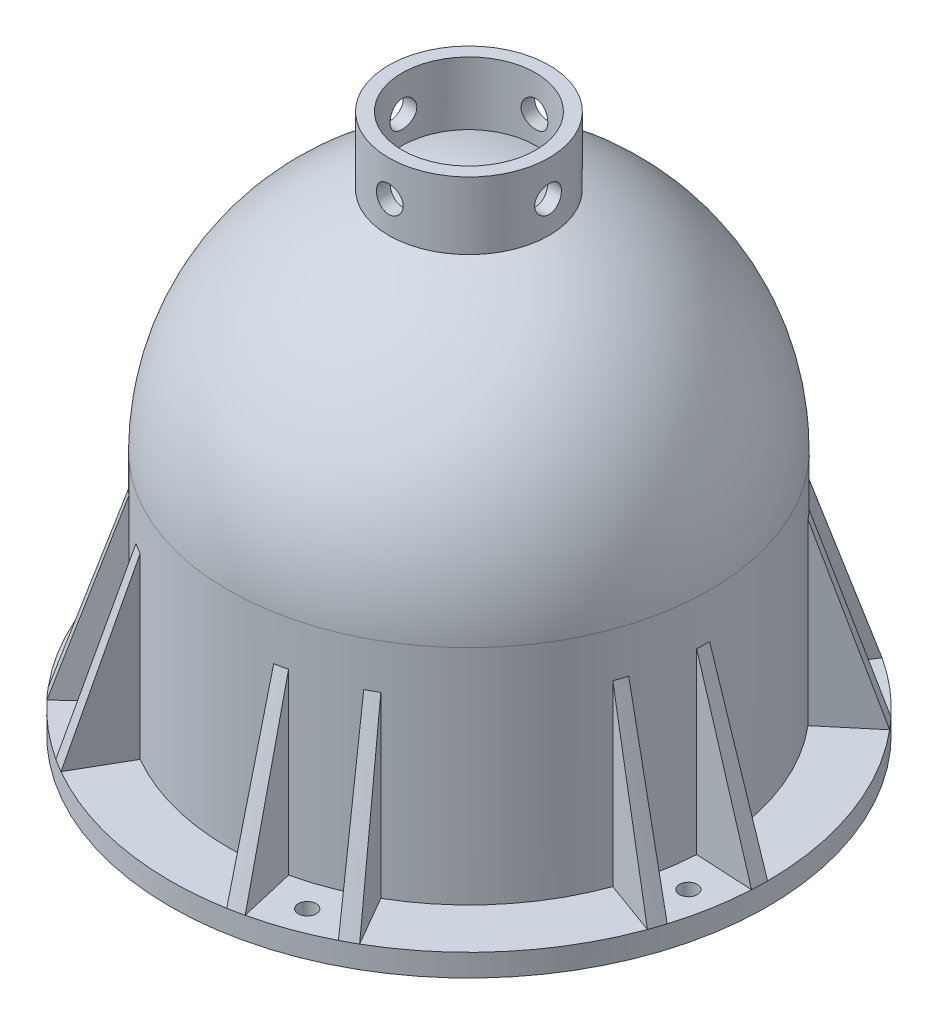
from build123d import *

# Parameters (mm, degrees)
FILLET1_R                = 2
FILLET3_R                = 1.5
REVOLVE2_ANGLE           = 3
CIRPATTERN1_COUNT        = 2
CIRPATTERN1_ANGLE        = 17
CUT_EXTRUDE1_REACH       = 142.691
SKETCH3_R                = 2
CIRPATTERN2_COUNT        = 6
CIRPATTERN2_COPY_1_ANGLE = 3
CIRPATTERN2_COPY_2_ANGLE = 3
CIRPATTERN2_COPY_3_ANGLE = 3
CIRPATTERN2_COPY_4_ANGLE = 3
CIRPATTERN2_COPY_5_ANGLE = 3
BOSS_EXTRUDE1_REACH      = 116.342
BOSS_EXTRUDE1_END_RADIUS = 50
SKETCH4_R                = 21
SKETCH4_R_2              = 18.5
BOSS_EXTRUDE2_REACH      = 116.342
BOSS_EXTRUDE2_END_RADIUS = 50
SKETCH6_R                = 1.25
CIRPATTERN3_COUNT        = 2
BOSS_EXTRUDE3_REACH      = 162.866
BOSS_EXTRUDE3_END_RADIUS = 54
SKETCH7_R                = 18
SKETCH7_R_2              = 15
SKETCH8_R                = 3
CUT_EXTRUDE2_DEPTH       = 116.472940553
CIRPATTERN4_COUNT        = 2
CIRPATTERN4_ANGLE        = 90


with BuildPart() as part:
    # Sketch1 → Revolve1 (revolve)
    with BuildSketch(Plane.XY, mode=Mode.PRIVATE) as revolve1_sk:
        with BuildLine():
            Line((54, 0), (54, -50))
            Line((54, -50), (67, -50))
            Line((67, -50), (67, -55))
            Line((67, -55), (50, -55))
            Line((50, -55), (50, -64))
            Line((50, -64), (46, -64))
            Line((46, -64), (46, -55))
            Line((46, -55), (46, -50))
            Line((46, -50), (50, -50))
            Line((50, -50), (50, 0))
            ThreePointArc((50, 0), (35.355339059, 35.355339059), (0, 50))
            Line((0, 50), (0, 54))
            ThreePointArc((0, 54), (38.183766184, 38.183766184), (54, 0))
        make_face()
    revolve(revolve1_sk.sketch.rotate(Axis((0, 98.537756866, 0), (0, -1, 0)), 90), axis=Axis((0, 98.537756866, 0), (0, -1, 0)))

    # Fillet1
    fillet1_edges = [part.edges().sort_by_distance(p)[0] for p in [
        (0, -50, -46),
        (0, -50, -50),
    ]]
    fillet(fillet1_edges, radius=FILLET1_R - 0.0001)  # a hair under: the kernel refuses the full size

    # Fillet3
    fillet3_edges = [part.edges().sort_by_distance(p)[0] for p in [
        (0, -64, -50),
        (0, -64, -46),
    ]]
    fillet(fillet3_edges, radius=FILLET3_R)

    # Sketch2 → Revolve2 (revolve)
    with BuildSketch(Plane.XY):
        Polygon((54, -10), (67, -50), (54, -50), align=None)
    revolve2 = revolve(axis=Axis((0, 98.537756866, 0), (0, -1, 0)), revolution_arc=REVOLVE2_ANGLE)

    # CirPattern1: Revolve2 ×2 about axis
    cirpattern1_axis = Axis((0, 0, 0), (0, -1, 0))
    for i in range(1, CIRPATTERN1_COUNT):
        add(revolve2.rotate(cirpattern1_axis, i * CIRPATTERN1_ANGLE / (CIRPATTERN1_COUNT - 1)))

    # Sketch3 → Cut-Extrude1 (cut, up to next)
    with BuildSketch(Plane(origin=(0, -50, 0), x_dir=(1, 0, 0), z_dir=(0, 1, 0)), mode=Mode.PRIVATE) as cut_extrude1_sk1:
        with Locations(Location((59.783225849, -10.541395711, 0), (0, 0, 270))):
            Circle(SKETCH3_R)
    cut_extrude1_tool1 = extrude(cut_extrude1_sk1.sketch, amount=-CUT_EXTRUDE1_REACH, mode=Mode.PRIVATE) & part.part
    cut_extrude1 = cut_extrude1_tool1.solids().sort_by_distance((59.783226, -50, 10.541396))[0]
    add(cut_extrude1, mode=Mode.SUBTRACT)

    # CirPattern2: Revolve2, Cut-Extrude1 ×6 about axis
    cirpattern2_axis = Axis((0, 0, 0), (0, 1, 0))
    add([revolve2.rotate(cirpattern2_axis, i * 360 / CIRPATTERN2_COUNT) for i in range(1, CIRPATTERN2_COUNT)])
    add([cut_extrude1.rotate(cirpattern2_axis, i * 360 / CIRPATTERN2_COUNT) for i in range(1, CIRPATTERN2_COUNT)], mode=Mode.SUBTRACT)

    # CirPattern2 copy 1 sketch → CirPattern2 copy 1 (revolve)
    with BuildSketch(Plane(origin=(0, 0, 0), x_dir=(0.7313537016191711, 0, -0.6819983600624979), z_dir=(0.6819983600624979, 0, 0.7313537016191711))):
        Polygon((54, -10), (67, -50), (54, -50), align=None)
    revolve(axis=Axis((0, 98.537756866, 0), (0, -1, 0)), revolution_arc=CIRPATTERN2_COPY_1_ANGLE)

    # CirPattern2 copy 2 sketch → CirPattern2 copy 2 (revolve)
    with BuildSketch(Plane(origin=(0, 0, 0), x_dir=(-0.2249510543438641, 0, -0.9743700647852354), z_dir=(0.9743700647852354, 0, -0.2249510543438641))):
        Polygon((54, -10), (67, -50), (54, -50), align=None)
    revolve(axis=Axis((0, 98.537756866, 0), (0, -1, 0)), revolution_arc=CIRPATTERN2_COPY_2_ANGLE)

    # CirPattern2 copy 3 sketch → CirPattern2 copy 3 (revolve)
    with BuildSketch(Plane(origin=(0, 0, 0), x_dir=(-0.9563047559630353, 0, -0.2923717047227375), z_dir=(0.2923717047227375, 0, -0.9563047559630353))):
        Polygon((54, -10), (67, -50), (54, -50), align=None)
    revolve(axis=Axis((0, 98.537756866, 0), (0, -1, 0)), revolution_arc=CIRPATTERN2_COPY_3_ANGLE)

    # CirPattern2 copy 4 sketch → CirPattern2 copy 4 (revolve)
    with BuildSketch(Plane(origin=(0, 0, 0), x_dir=(-0.7313537016191713, 0, 0.6819983600624976), z_dir=(-0.6819983600624976, 0, -0.7313537016191713))):
        Polygon((54, -10), (67, -50), (54, -50), align=None)
    revolve(axis=Axis((0, 98.537756866, 0), (0, -1, 0)), revolution_arc=CIRPATTERN2_COPY_4_ANGLE)

    # CirPattern2 copy 5 sketch → CirPattern2 copy 5 (revolve)
    with BuildSketch(Plane(origin=(0, 0, 0), x_dir=(0.22495105434386448, 0, 0.9743700647852354), z_dir=(-0.9743700647852354, 0, 0.22495105434386448))):
        Polygon((54, -10), (67, -50), (54, -50), align=None)
    revolve(axis=Axis((0, 98.537756866, 0), (0, -1, 0)), revolution_arc=CIRPATTERN2_COPY_5_ANGLE)

    # Boss-Extrude1: up to this sphere (the profile starts inside it)
    boss_extrude1_end = Location((0, 0, 0)) * Sphere(BOSS_EXTRUDE1_END_RADIUS, mode=Mode.PRIVATE)
    # Sketch4 → Boss-Extrude1 (add, up to the surface)
    with BuildSketch(Plane(origin=(0, 0, 0), x_dir=(1, 0, 0), z_dir=(0, 1, 0)), mode=Mode.PRIVATE) as boss_extrude1_sk1:
        with Locations(Location((0, 0, 0), (0, 0, 90))):
            Circle(SKETCH4_R)
        with Locations(Location((0, 0, 0), (0, 0, 90))):
            Circle(SKETCH4_R_2, mode=Mode.SUBTRACT)
    boss_extrude1_tool1 = extrude(boss_extrude1_sk1.sketch, amount=BOSS_EXTRUDE1_REACH, mode=Mode.PRIVATE) & boss_extrude1_end
    add(boss_extrude1_tool1.solids().sort_by_distance((0, 0, 20.40603))[0])

    # Boss-Extrude2: up to this sphere (the profile starts inside it)
    boss_extrude2_end = Location((0, 0, 0)) * Sphere(BOSS_EXTRUDE2_END_RADIUS, mode=Mode.PRIVATE)
    # Sketch6 → Boss-Extrude2 (add, up to the surface)
    with BuildSketch(Plane(origin=(0, 0, 0), x_dir=(1, 0, 0), z_dir=(0, 1, 0)), mode=Mode.PRIVATE) as boss_extrude2_sk1:
        with BuildLine():
            Line((-29.430717857, -40.420698243), (-29.430717857, -31.6388171))
            ThreePointArc((-29.430717857, -31.6388171), (-30.759144982, -30.759144982), (-31.6388171, -29.430717857))
            Line((-31.6388171, -29.430717857), (-40.420698243, -29.430717857))
            ThreePointArc((-40.420698243, -29.430717857), (-41.45904567, -27.949016658), (-42.4431049, -26.430717857))
            Line((-42.4431049, -26.430717857), (-31.6388171, -26.430717857))
            ThreePointArc((-31.6388171, -26.430717857), (-25.102290732, -25.102290732), (-26.430717857, -31.6388171))
            Line((-26.430717857, -31.6388171), (-26.430717857, -42.4431049))
            ThreePointArc((-26.430717857, -42.4431049), (-27.949016658, -41.45904567), (-29.430717857, -40.420698243))
        make_face()
        with Locations(Location((-27.930717857, -27.930717857, 0), (0, 0, 225))):
            Circle(SKETCH6_R, mode=Mode.SUBTRACT)
    boss_extrude2_tool1 = extrude(boss_extrude2_sk1.sketch, amount=BOSS_EXTRUDE2_REACH, mode=Mode.PRIVATE) & boss_extrude2_end
    boss_extrude2 = boss_extrude2_tool1.solids().sort_by_distance((-30.36154, 0, 30.36154))[0]
    add(boss_extrude2)

    # CirPattern3: Boss-Extrude2 ×2 about axis
    cirpattern3_axis = Axis((0, 0, 0), (0, 1, 0))
    for i in range(1, CIRPATTERN3_COUNT):
        add(boss_extrude2.rotate(cirpattern3_axis, i * 360 / CIRPATTERN3_COUNT))

    # Boss-Extrude3: up to this sphere (the profile starts outside it)
    boss_extrude3_end = Location((0, 0, 0)) * Sphere(BOSS_EXTRUDE3_END_RADIUS, mode=Mode.PRIVATE)
    # Sketch7 → Boss-Extrude3 (add, up to the surface)
    with BuildSketch(Plane(origin=(0, 66, 0), x_dir=(1, 0, 0), z_dir=(0, 1, 0)), mode=Mode.PRIVATE) as boss_extrude3_sk1:
        with Locations(Location((0, 0, 0), (0, 0, 270))):
            Circle(SKETCH7_R)
        with Locations(Location((0, 0, 0), (0, 0, 270))):
            Circle(SKETCH7_R_2, mode=Mode.SUBTRACT)
    boss_extrude3_tool1 = extrude(boss_extrude3_sk1.sketch, amount=-BOSS_EXTRUDE3_REACH, mode=Mode.PRIVATE) - boss_extrude3_end
    add(boss_extrude3_tool1.solids().sort_by_distance((0, 66, -17.490883))[0])

    # Sketch8 → Cut-Extrude2 (cut, symmetric)
    with BuildSketch(Plane.XY):
        with Locations((0, 58)):
            Circle(SKETCH8_R)
    cut_extrude2 = extrude(amount=CUT_EXTRUDE2_DEPTH, both=True, mode=Mode.SUBTRACT)

    # CirPattern4: Cut-Extrude2 ×2 about axis
    cirpattern4_axis = Axis((0, 98.537756866, 0), (0, -1, 0))
    for i in range(1, CIRPATTERN4_COUNT):
        add(cut_extrude2.rotate(cirpattern4_axis, i * CIRPATTERN4_ANGLE / (CIRPATTERN4_COUNT - 1)), mode=Mode.SUBTRACT)


solid = part.part
